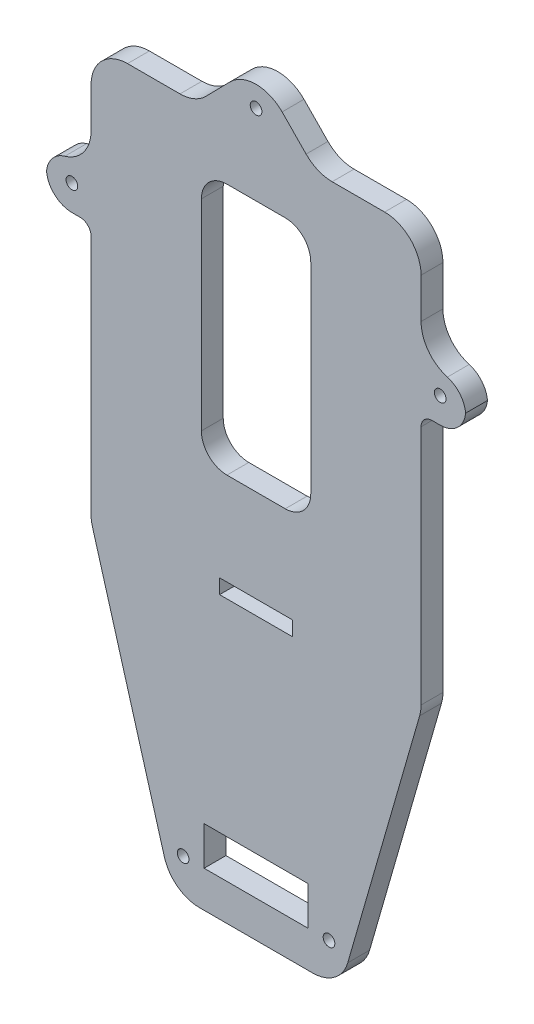
from build123d import *

# Parameters (mm, degrees)
ESBO_O1_R                = 1.6
ESBO_O1_W                = 28.5
ESBO_O1_H                = 10.6
ESBO_O1_W_2              = 30
ESBO_O1_H_2              = 69.1
ESBO_O1_W_3              = 20
ESBO_O1_H_3              = 4
RESSALTO_EXTRUS_O1_DEPTH = 6
FILETE3_R                = 3
FILETE4_R                = 10
FILETE5_R                = 7
ESBO_O2_R                = 1.6
CORTE_EXTRUS_O1_DEPTH    = 10


with BuildPart() as part:
    # Esboço1 → Ressalto-extrusão1 (new body)
    with BuildSketch(Plane.XY):
        Polygon((-45.25, -56.75), (-23.05952475, -133.85), (23.05952475, -133.85), (45.25, -56.75), (45.25, 13.75), (57.5, 13.75), (57.5, 25.75), (45.25, 25.75), (45.25, 56.75), (16.663333, 56.75), (0, 73.75), (-16.663333, 56.75), (-45.25, 56.75), (-45.25, 25.75), (-57.5, 25.75), (-57.5, 13.75), (-45.25, 13.75), align=None)
        with Locations((0, 63.75)):
            Circle(ESBO_O1_R, mode=Mode.SUBTRACT)
        with Locations((-50.5, 20.75)):
            Circle(ESBO_O1_R, mode=Mode.SUBTRACT)
        with Locations((50.5, 20.75)):
            Circle(ESBO_O1_R, mode=Mode.SUBTRACT)
        with Locations((0, -118.55)):
            Rectangle(ESBO_O1_W, ESBO_O1_H, mode=Mode.SUBTRACT)
        with Locations((0, 7.2)):
            Rectangle(ESBO_O1_W_2, ESBO_O1_H_2, mode=Mode.SUBTRACT)
        with Locations((0, -54.75)):
            Rectangle(ESBO_O1_W_3, ESBO_O1_H_3, mode=Mode.SUBTRACT)
    extrude(amount=RESSALTO_EXTRUS_O1_DEPTH)

    # Filete3
    filete3_edges = [part.edges().sort_by_distance(p)[0] for p in [
        (-45.25, 13.75, 3),
        (45.25, 13.75, 3),
    ]]
    fillet(filete3_edges, radius=FILETE3_R)

    # Filete4
    filete4_edges = [part.edges().sort_by_distance(p)[0] for p in [
        (-45.25, 25.75, 3),
        (-45.25, 56.75, 3),
        (-16.663333, 56.75, 3),
        (0, 73.75, 3),
        (16.663333, 56.75, 3),
        (45.25, 56.75, 3),
        (45.25, 25.75, 3),
        (45.25, -56.75, 3),
        (23.05952475, -133.85, 3),
        (-23.05952475, -133.85, 3),
        (-45.25, -56.75, 3),
    ]]
    fillet(filete4_edges, radius=FILETE4_R)

    # Filete5
    # the kernel refuses this fillet: 7 mm, written as the material it adds along each edge
    with BuildSketch(Plane(origin=(-15, -27.35, 0), x_dir=(1, 0, 0), z_dir=(0, 0, 1)), Plane(origin=(15, 41.75, 0), x_dir=(-1, 0, 0), z_dir=(0, 0, 1)), Plane(origin=(-15, 41.75, 0), x_dir=(0, -1, 0), z_dir=(0, 0, 1))) as filete5_piece_1:
        with BuildLine():
            CenterArc((FILETE5_R, FILETE5_R), FILETE5_R, 180, 90)
            Line((0, FILETE5_R), (0, 0))
            Line((0, 0), (FILETE5_R, 0))
        make_face()
    extrude(amount=6)
    with BuildSketch(Plane(origin=(15, -27.35, 0), x_dir=(-1, 0, 0), z_dir=(0, 0, 1))) as filete5_piece_2:
        with BuildLine():
            CenterArc((FILETE5_R, -FILETE5_R), FILETE5_R, 90, 90)
            Line((0, -FILETE5_R), (0, 0))
            Line((0, 0), (FILETE5_R, 0))
        make_face()
    extrude(amount=6)
    # the kernel refuses this fillet: 7 mm, written as the material it takes off along each edge
    with BuildSketch(Plane(origin=(57.5, 13.75, -17.5), x_dir=(-1, 0, 0), z_dir=(0, 0, 1))) as filete5_2_piece_1:
        with BuildLine():
            CenterArc((FILETE5_R, -FILETE5_R), FILETE5_R, 90, 90)
            Line((0, -FILETE5_R), (0, 0))
            Line((0, 0), (FILETE5_R, 0))
        make_face()
    extrude(amount=41, mode=Mode.SUBTRACT)
    with BuildSketch(Plane(origin=(57.5, 25.75, -15.807283357), x_dir=(0, -1, 0), z_dir=(0, 0, 1))) as filete5_2_piece_2:
        with BuildLine():
            CenterArc((6.322913343, -7), FILETE5_R, 90, 73.774899865)
            Line((-0.398286269, -5.044117647), (-1.07040623, -4.848529412))
            ThreePointArc((-1.07040623, -4.848529412), (-0.7, -2.25), (-0.7, 0))
            Line((-0.7, 0), (0, 0.7))
            Line((0, 0.7), (6.322913343, 0.7))
            Line((6.322913343, 0.7), (6.322913343, 0))
        make_face()
    extrude(amount=37.614566715, mode=Mode.SUBTRACT)
    with BuildSketch(Plane(origin=(-57.5, 13.75, -17.5), x_dir=(1, 0, 0), z_dir=(0, 0, 1))) as filete5_2_piece_3:
        with BuildLine():
            CenterArc((FILETE5_R, FILETE5_R), FILETE5_R, 180, 90)
            Line((0, FILETE5_R), (0, 0))
            Line((0, 0), (FILETE5_R, 0))
        make_face()
    extrude(amount=41, mode=Mode.SUBTRACT)
    with BuildSketch(Plane(origin=(-57.5, 25.75, -15.807283357), x_dir=(0, -1, 0), z_dir=(0, 0, 1))) as filete5_2_piece_4:
        with BuildLine():
            CenterArc((6.322913343, 7), FILETE5_R, 196.225100135, 73.774899865)
            Line((-0.398286269, 5.044117647), (-1.07040623, 4.848529412))
            ThreePointArc((-1.07040623, 4.848529412), (-0.7, 2.25), (-0.7, 0))
            Line((-0.7, 0), (0, -0.7))
            Line((0, -0.7), (6.322913343, -0.7))
            Line((6.322913343, -0.7), (6.322913343, 0))
        make_face()
    extrude(amount=37.614566715, mode=Mode.SUBTRACT)

    # Esboço2 → Corte-extrusão1 (cut)
    with BuildSketch(Plane.XY.offset(6)):
        with Locations((-20, -123.85)):
            Circle(ESBO_O2_R)
        with Locations((20, -123.85)):
            Circle(ESBO_O2_R)
    extrude(amount=-CORTE_EXTRUS_O1_DEPTH, mode=Mode.SUBTRACT)


solid = part.part
